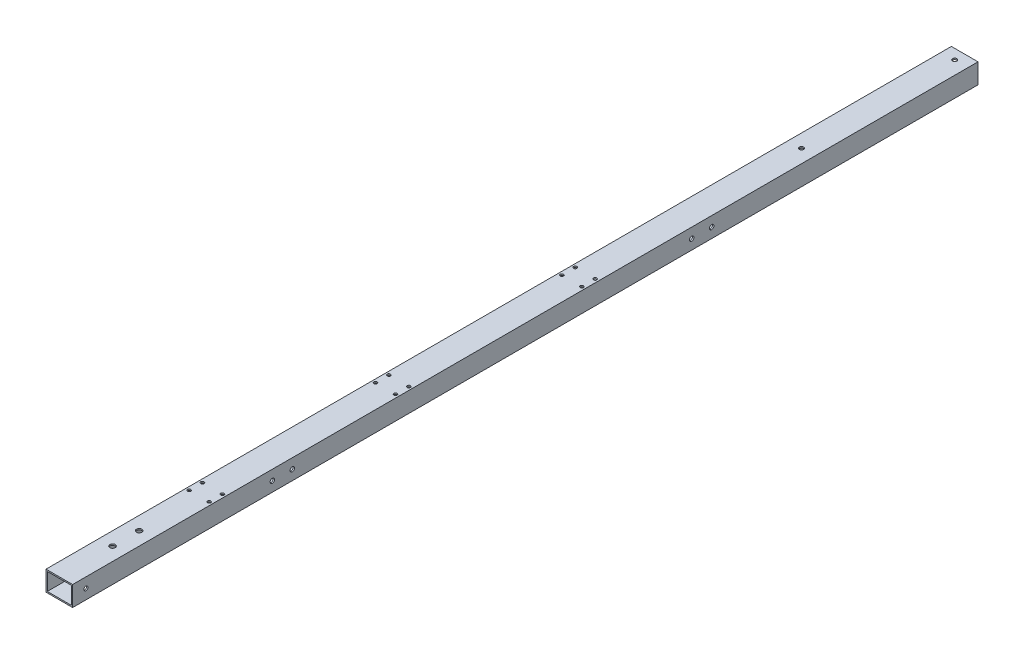
from build123d import *

# Parameters (mm, degrees)
SKETCH_1_W           = 20
SKETCH_1_H           = 15
SKETCH_1_W_2         = 18
SKETCH_1_H_2         = 13
EXTRUDE_1_DEPTH      = 800
SKETCH_4_R           = 1.5
CUT_EXTRUDE_3_DEPTH  = 801.390529679
SKETCH_5_R           = 1.65
CUT_EXTRUDE_4_DEPTH  = 801.390529679
SKETCH_6_W           = 20
SKETCH_6_H           = 15
CUT_EXTRUDE_5_DEPTH  = 300
SKETCH_7_R           = 1.25
CUT_EXTRUDE_6_DEPTH  = 155
SKETCH_8_W           = 20
SKETCH_8_H           = 15
SKETCH_8_W_2         = 18
SKETCH_8_H_2         = 13
EXTRUDE_1_2_DEPTH    = 180
SKETCH_9_R           = 2.05
CUT_EXTRUDE_7_DEPTH  = 10
CUT_EXTRUDE_8_DEPTH  = 10
SKETCH_11_R          = 1.6
CUT_EXTRUDE_9_DEPTH  = 801.390529679
CUT_EXTRUDE_10_REACH = 802.391


with BuildPart() as part:
    # 草图1 → Extrude 1 (new body)
    with BuildSketch(Plane.XY):
        with Locations((10, -7.5)):
            Rectangle(SKETCH_1_W, SKETCH_1_H)
        with Locations((10, -7.5)):
            Rectangle(SKETCH_1_W_2, SKETCH_1_H_2, mode=Mode.SUBTRACT)
    extrude(amount=EXTRUDE_1_DEPTH)

    # 草图4 → 切除-拉伸3 (cut, through all)
    with BuildSketch(Plane(origin=(20, 0, 0), x_dir=(0, 0, -1), z_dir=(1, 0, 0))):
        with Locations((-790, -7.5)):
            Circle(SKETCH_4_R)
    extrude(amount=-CUT_EXTRUDE_3_DEPTH, mode=Mode.SUBTRACT)

    # 草图5 → 切除-拉伸4 (cut, through all)
    with BuildSketch(Plane(origin=(20, 0, 0), x_dir=(0, 0, -1), z_dir=(1, 0, 0))):
        with Locations((-320, -7.5)):
            Circle(SKETCH_5_R)
        with Locations((-335, -7.5)):
            Circle(SKETCH_5_R)
        with Locations((-635, -7.5)):
            Circle(SKETCH_5_R)
        with Locations((-650, -7.5)):
            Circle(SKETCH_5_R)
    extrude(amount=-CUT_EXTRUDE_4_DEPTH, mode=Mode.SUBTRACT)

    # 草图6 → 切除-拉伸5 (cut)
    with BuildSketch(Plane(origin=(0, 0, 0), x_dir=(-1, 0, 0), z_dir=(0, 0, -1))):
        with Locations((-10, -7.5)):
            Rectangle(SKETCH_6_W, SKETCH_6_H)
    extrude(amount=-CUT_EXTRUDE_5_DEPTH, mode=Mode.SUBTRACT)

    # 草图7 → 切除-拉伸6 (cut)
    with BuildSketch(Plane(origin=(0, 0, 0), x_dir=(1, 0, 0), z_dir=(0, 1, 0))):
        with Locations((2.5, -545)):
            Circle(SKETCH_7_R)
        with Locations((17.5, -545)):
            Circle(SKETCH_7_R)
        with Locations((17.5, -555)):
            Circle(SKETCH_7_R)
        with Locations((2.5, -555)):
            Circle(SKETCH_7_R)
        with Locations((2.5, -405)):
            Circle(SKETCH_7_R)
        with Locations((17.5, -405)):
            Circle(SKETCH_7_R)
        with Locations((17.5, -415)):
            Circle(SKETCH_7_R)
        with Locations((2.5, -415)):
            Circle(SKETCH_7_R)
        with Locations((2.5, -685)):
            Circle(SKETCH_7_R)
        with Locations((17.5, -685)):
            Circle(SKETCH_7_R)
        with Locations((17.5, -695)):
            Circle(SKETCH_7_R)
        with Locations((2.5, -695)):
            Circle(SKETCH_7_R)
    extrude(amount=-CUT_EXTRUDE_6_DEPTH, mode=Mode.SUBTRACT)

    # 草图8 → Extrude 1 2 (add)
    with BuildSketch(Plane(origin=(0, 0, 300), x_dir=(-1, 0, 0), z_dir=(0, 0, -1))):
        with Locations((-10, -7.5)):
            Rectangle(SKETCH_8_W, SKETCH_8_H)
        with Locations((-10, -7.5)):
            Rectangle(SKETCH_8_W_2, SKETCH_8_H_2, mode=Mode.SUBTRACT)
    extrude(amount=EXTRUDE_1_2_DEPTH)

    # 草图9 → 切除-拉伸7 (cut)
    with BuildSketch(Plane(origin=(0, 0, 0), x_dir=(1, 0, 0), z_dir=(0, 1, 0))):
        with Locations((10, -740)):
            Circle(SKETCH_9_R)
        with Locations((10, -760)):
            Circle(SKETCH_9_R)
    extrude(amount=-CUT_EXTRUDE_7_DEPTH, mode=Mode.SUBTRACT)

    # 草图10 → 切除-拉伸8 (cut)
    with BuildSketch(Plane.XZ.offset(15)):
        with BuildLine():
            Line((6, 765), (6, 785))
            ThreePointArc((6, 785), (10, 789), (14, 785))
            Line((14, 785), (14, 765))
            ThreePointArc((14, 765), (10, 761), (6, 765))
        make_face()
    extrude(amount=-CUT_EXTRUDE_8_DEPTH, mode=Mode.SUBTRACT)

    # 草图11 → 切除-拉伸9 (cut, through all)
    with BuildSketch(Plane.XZ.offset(15)):
        with Locations((10, 127.5)):
            Circle(SKETCH_11_R)
        with Locations((10, 242.5)):
            Circle(SKETCH_11_R)
    extrude(amount=-CUT_EXTRUDE_9_DEPTH, mode=Mode.SUBTRACT)

    # 草图12 → 切除-拉伸10 (cut, up to next)
    with BuildSketch(Plane.XZ.offset(15), mode=Mode.PRIVATE) as cut_extrude_10_sk1:
        with BuildLine():
            Line((15, 248), (15, 238))
            ThreePointArc((15, 238), (10, 233), (5, 238))
            Line((5, 238), (5, 248))
            ThreePointArc((5, 248), (10, 253), (15, 248))
        make_face()
    cut_extrude_10_tool1 = extrude(cut_extrude_10_sk1.sketch, amount=-CUT_EXTRUDE_10_REACH, mode=Mode.PRIVATE) & part.part
    add(cut_extrude_10_tool1.solids().sort_by_distance((10, -15, 243))[0], mode=Mode.SUBTRACT)


solid = part.part
